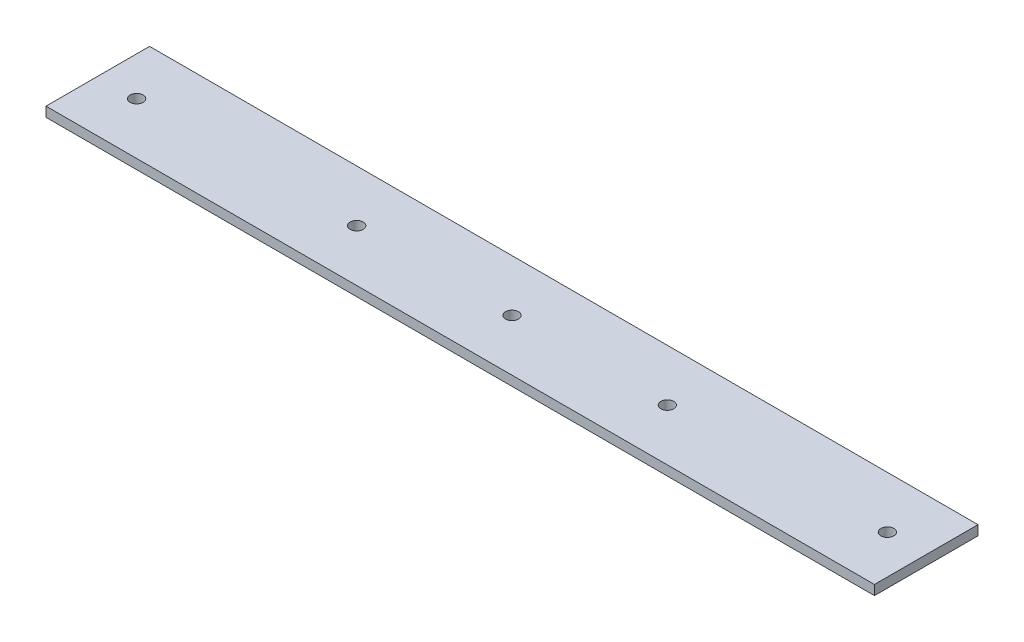
from build123d import *

# Parameters (mm, degrees)
SKETCH1_W           = 406.4
SKETCH1_H           = 50.8
BOSS_EXTRUDE1_DEPTH = 4.7625
SKETCH2_R           = 3.175
CUT_EXTRUDE1_DEPTH  = 244.602
SKETCH3_R           = 3.175
CUT_EXTRUDE2_DEPTH  = 244.602


with BuildPart() as part:
    # Sketch1 → Boss-Extrude1 (new body)
    with BuildSketch(Plane(origin=(0, 0, 0), x_dir=(1, 0, 0), z_dir=(0, 1, 0))):
        with Locations((203.2, 25.4)):
            Rectangle(SKETCH1_W, SKETCH1_H)
    extrude(amount=BOSS_EXTRUDE1_DEPTH)

    # Sketch2 → Cut-Extrude1 (cut)
    with BuildSketch(Plane(origin=(0, 4.7625, 0), x_dir=(1, 0, 0), z_dir=(0, 1, 0))):
        with Locations((19.05, 25.4)):
            Circle(SKETCH2_R)
        with Locations((387.35, 25.4)):
            Circle(SKETCH2_R)
    extrude(amount=-CUT_EXTRUDE1_DEPTH, mode=Mode.SUBTRACT)

    # Sketch3 → Cut-Extrude2 (cut)
    with BuildSketch(Plane(origin=(0, 4.7625, 0), x_dir=(1, 0, 0), z_dir=(0, 1, 0))):
        with Locations((279.4, 25.4)):
            Circle(SKETCH3_R)
        with Locations((203.2, 25.4)):
            Circle(SKETCH3_R)
        with Locations((127, 25.4)):
            Circle(SKETCH3_R)
    extrude(amount=-CUT_EXTRUDE2_DEPTH, mode=Mode.SUBTRACT)


solid = part.part
